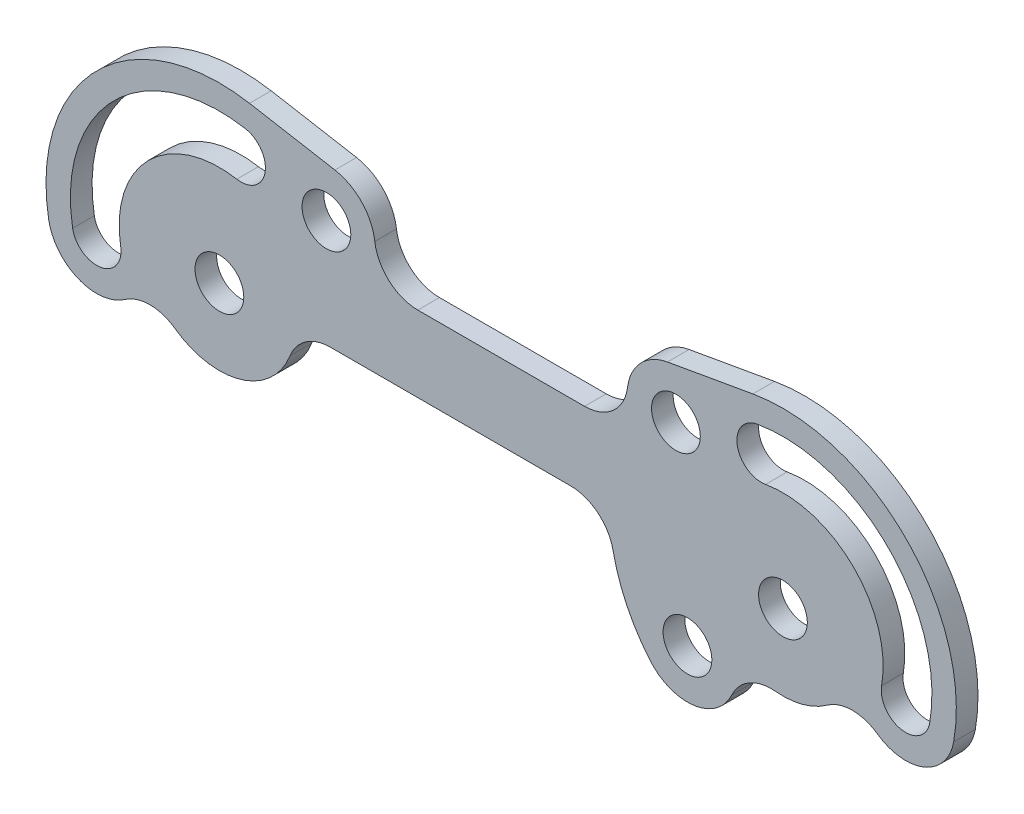
from build123d import *

# Parameters (mm, degrees)
SKETCH1_R           = 1.7859375
BOSS_EXTRUDE1_DEPTH = 1.5875
FILLET1_R           = 3.175


with BuildPart() as part:
    # Sketch1 → Boss-Extrude1 (new body)
    with BuildSketch(Plane.XY):
        with BuildLine():
            ThreePointArc((7.9375, 0), (8.703403716, -4.34365582), (10.908735572, -8.163402643))
            ThreePointArc((10.908735572, -8.163402643), (15.940907514, -8.603660684), (16.381165642, -3.57148875))
            ThreePointArc((16.381165642, -3.57148875), (22.075563347, -5.366925365), (26.109338066, -0.964832752))
            ThreePointArc((26.109338066, -0.964832752), (29.006698718, -5.10269247), (33.144558463, -2.205331856))
            ThreePointArc((33.144558463, -2.205331856), (29.617756121, 8.980256121), (18.432168144, 12.507058463))
            Line((18.432168144, 12.507058463), (12.178638912, 11.404392535))
            ThreePointArc((12.178638912, 11.404392535), (9.43473159, 9.087090354), (10.092061938, 5.55625))
            Line((10.092061938, 5.55625), (-10.092061938, 5.55625))
            ThreePointArc((-10.092061938, 5.55625), (-9.43473159, 9.087090354), (-12.178638912, 11.404392535))
            Line((-12.178638912, 11.404392535), (-18.432168144, 12.507058463))
            ThreePointArc((-18.432168144, 12.507058463), (-29.617756121, 8.980256121), (-33.144558463, -2.205331856))
            ThreePointArc((-33.144558463, -2.205331856), (-29.006698655, -5.102692459), (-26.109338088, -0.964832626))
            ThreePointArc((-26.109338088, -0.964832626), (-20.153240935, -5.535106794), (-15.08125, 0))
            Line((-15.08125, 0), (7.9375, 0))
        make_face()
        with Locations((12.798888497, 7.886782342)):
            Circle(SKETCH1_R, mode=Mode.SUBTRACT)
        with BuildLine():
            ThreePointArc((18.742292936, 10.748253367), (28.354907604, 7.717407604), (31.385753367, -1.895207064))
            ThreePointArc((31.385753367, -1.895207064), (29.316823478, -3.343887368), (27.868143174, -1.274957479))
            ThreePointArc((27.868143174, -1.274957479), (25.82921057, 5.19171057), (19.362542521, 7.230643174))
            ThreePointArc((19.362542521, 7.230643174), (17.293612632, 8.679323478), (18.742292936, 10.748253367))
        make_face(mode=Mode.SUBTRACT)
        with Locations((20.6375, 0)):
            Circle(SKETCH1_R, mode=Mode.SUBTRACT)
        with Locations((-20.6375, 0)):
            Circle(SKETCH1_R, mode=Mode.SUBTRACT)
        with BuildLine():
            ThreePointArc((-19.362542521, 7.230643174), (-25.82921057, 5.19171057), (-27.868143174, -1.274957479))
            ThreePointArc((-27.868143174, -1.274957479), (-29.316823478, -3.343887368), (-31.385753367, -1.895207064))
            ThreePointArc((-31.385753367, -1.895207064), (-28.354907604, 7.717407604), (-18.742292936, 10.748253367))
            ThreePointArc((-18.742292936, 10.748253367), (-17.293612632, 8.679323478), (-19.362542521, 7.230643174))
        make_face(mode=Mode.SUBTRACT)
        with Locations((-12.798888497, 7.886782342)):
            Circle(SKETCH1_R, mode=Mode.SUBTRACT)
        with Locations((13.644950568, -5.86744565)):
            Circle(SKETCH1_R, mode=Mode.SUBTRACT)
    extrude(amount=BOSS_EXTRUDE1_DEPTH)

    # Fillet1
    fillet1_edges = [part.edges().sort_by_distance(p)[0] for p in [
        (-26.109338088, -0.964832626, 0.79375),
        (-15.08125, 0, 0.79375),
        (-10.092061938, 5.55625, 0.79375),
        (26.109338066, -0.964832752, 0.79375),
        (16.381165642, -3.57148875, 0.79375),
        (10.092061938, 5.55625, 0.79375),
        (7.9375, 0, 0.79375),
    ]]
    fillet(fillet1_edges, radius=FILLET1_R)


solid = part.part
